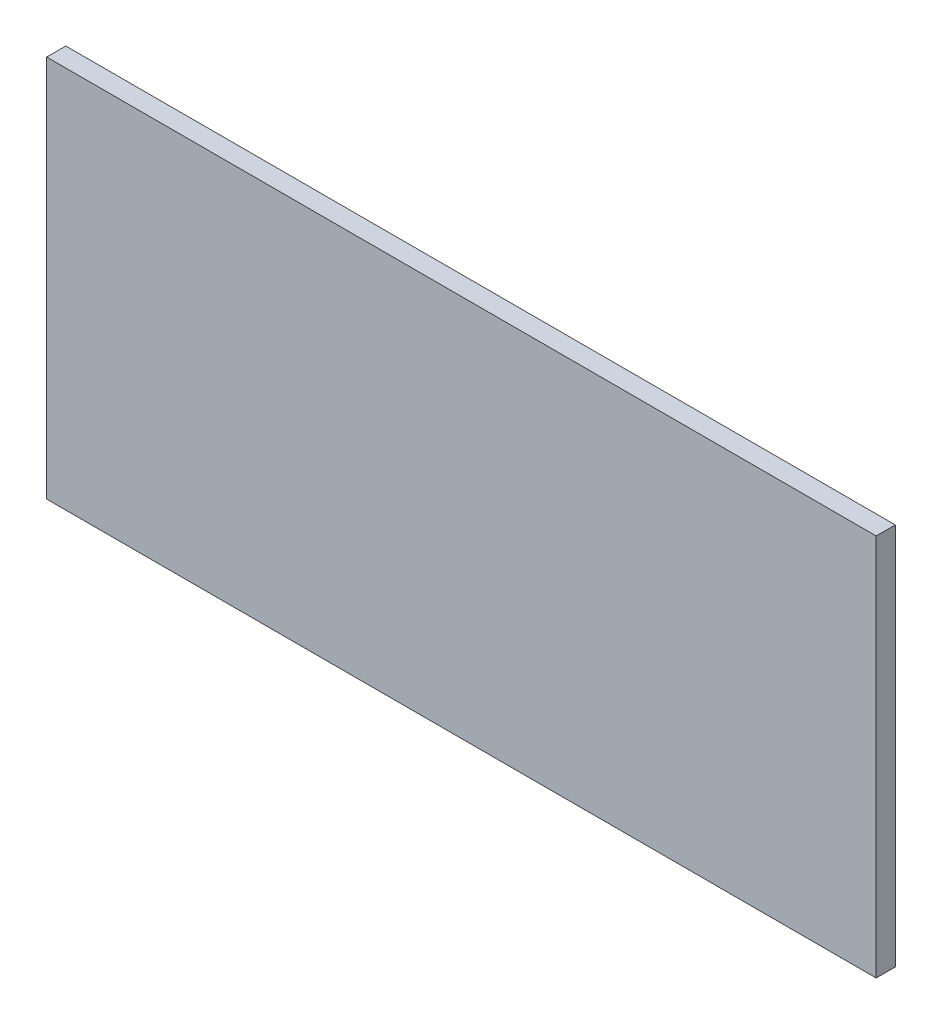
from build123d import *

# Parameters (mm, degrees)
SKETCH1_W           = 65
SKETCH1_H           = 30
BOSS_EXTRUDE1_DEPTH = 1.5
BOSS_EXTRUDE2_DEPTH = 1.5


with BuildPart() as part:
    # Sketch1 → Boss-Extrude1 (new body)
    with BuildSketch(Plane.XY):
        with Locations((125.94074046, -0.055)):
            Rectangle(SKETCH1_W, SKETCH1_H)
    extrude(amount=-BOSS_EXTRUDE1_DEPTH)


with BuildPart() as body_2:
    # Sketch2 → Boss-Extrude2 (new body)
    with BuildSketch(Plane(origin=(0, 0, -1.5), x_dir=(-1, 0, 0), z_dir=(0, 0, -1))):
        with BuildLine():
            Line((-148.44074046, 9.445), (-103.44074046, 9.445))
            ThreePointArc((-103.44074046, 9.445), (-101.672973507, 8.712766953), (-100.94074046, 6.945))
            Line((-100.94074046, 6.945), (-100.94074046, -7.055))
            ThreePointArc((-100.94074046, -7.055), (-101.672973507, -8.822766953), (-103.44074046, -9.555))
            Line((-103.44074046, -9.555), (-148.44074046, -9.555))
            ThreePointArc((-148.44074046, -9.555), (-150.208507413, -8.822766953), (-150.94074046, -7.055))
            Line((-150.94074046, -7.055), (-150.94074046, 6.945))
            ThreePointArc((-150.94074046, 6.945), (-150.208507413, 8.712766953), (-148.44074046, 9.445))
        make_face()
    extrude(amount=BOSS_EXTRUDE2_DEPTH)


solid = Compound([part.part, body_2.part])
